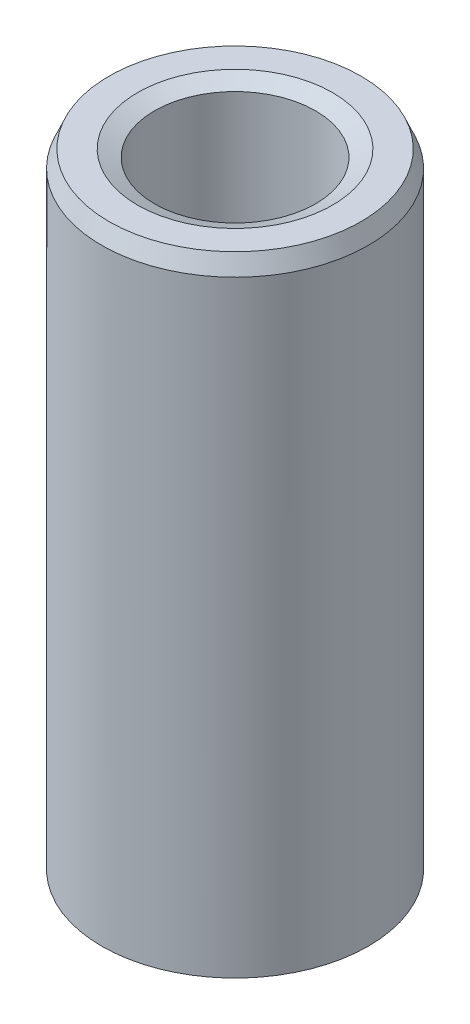
from build123d import *
from OCP.BRepFilletAPI import BRepFilletAPI_MakeChamfer

# Parameters (mm, degrees)
SKETCH1_R           = 22.5
BOSS_EXTRUDE1_DEPTH = 106.518927393
SKETCH2_R           = 13.597908624
CUT_EXTRUDE1_DEPTH  = 112.170058437
CHAMFER1_SIZE       = 2.857584006
CHAMFER1_SIZE2      = 1.234126687


with BuildPart() as part:
    # Sketch1 → Boss-Extrude1 (new body)
    with BuildSketch(Plane(origin=(0, 0, 0), x_dir=(1, 0, 0), z_dir=(0, 1, 0))):
        Circle(SKETCH1_R)
    extrude(amount=BOSS_EXTRUDE1_DEPTH)

    # Sketch2 → Cut-Extrude1 (cut, through all)
    with BuildSketch(Plane(origin=(0, 0, 0), x_dir=(1, 0, 0), z_dir=(0, 1, 0))):
        Circle(SKETCH2_R)
    extrude(amount=CUT_EXTRUDE1_DEPTH, mode=Mode.SUBTRACT)

    # Chamfer1: one chamfer whose edges measure the first distance from different faces: ONE call of the kernel's chamfer builder (chamfer() names one face for all edges)
    chamfer1_edges_1 = [part.edges().sort_by_distance(p)[0] for p in [
        (-13.597908624, 106.518927393, 0),
    ]]
    chamfer1_side_1 = [part.faces().sort_by_distance(p)[0] for p in [
        (-21.863603897, 106.518927393, 0),
    ]]
    chamfer1_edges_2 = [part.edges().sort_by_distance(p)[0] for p in [
        (-13.597908624, 0, 0),
    ]]
    chamfer1_side_2 = [part.faces().sort_by_distance(p)[0] for p in [
        (-13.597908624, 53.259463697, 0),
    ]]
    chamfer1_edges_3 = [part.edges().sort_by_distance(p)[0] for p in [
        (-22.5, 0, 0),
    ]]
    chamfer1_side_3 = [part.faces().sort_by_distance(p)[0] for p in [
        (-21.863603897, 0, 0),
    ]]
    chamfer1_edges_4 = [part.edges().sort_by_distance(p)[0] for p in [
        (-22.5, 106.518927393, 0),
    ]]
    chamfer1_side_4 = [part.faces().sort_by_distance(p)[0] for p in [
        (-22.5, 53.259463697, 0),
    ]]
    chamfer1 = BRepFilletAPI_MakeChamfer(part.part.solid().wrapped)
    for e in chamfer1_edges_1:
        chamfer1.Add(CHAMFER1_SIZE, CHAMFER1_SIZE2, e.wrapped, chamfer1_side_1[0].wrapped)  # the first distance lies on this face
    for e in chamfer1_edges_2:
        chamfer1.Add(CHAMFER1_SIZE, CHAMFER1_SIZE2, e.wrapped, chamfer1_side_2[0].wrapped)  # the first distance lies on this face
    for e in chamfer1_edges_3:
        chamfer1.Add(CHAMFER1_SIZE, CHAMFER1_SIZE2, e.wrapped, chamfer1_side_3[0].wrapped)  # the first distance lies on this face
    for e in chamfer1_edges_4:
        chamfer1.Add(CHAMFER1_SIZE, CHAMFER1_SIZE2, e.wrapped, chamfer1_side_4[0].wrapped)  # the first distance lies on this face
    add(Compound.cast(chamfer1.Shape()), mode=Mode.REPLACE)


solid = part.part
